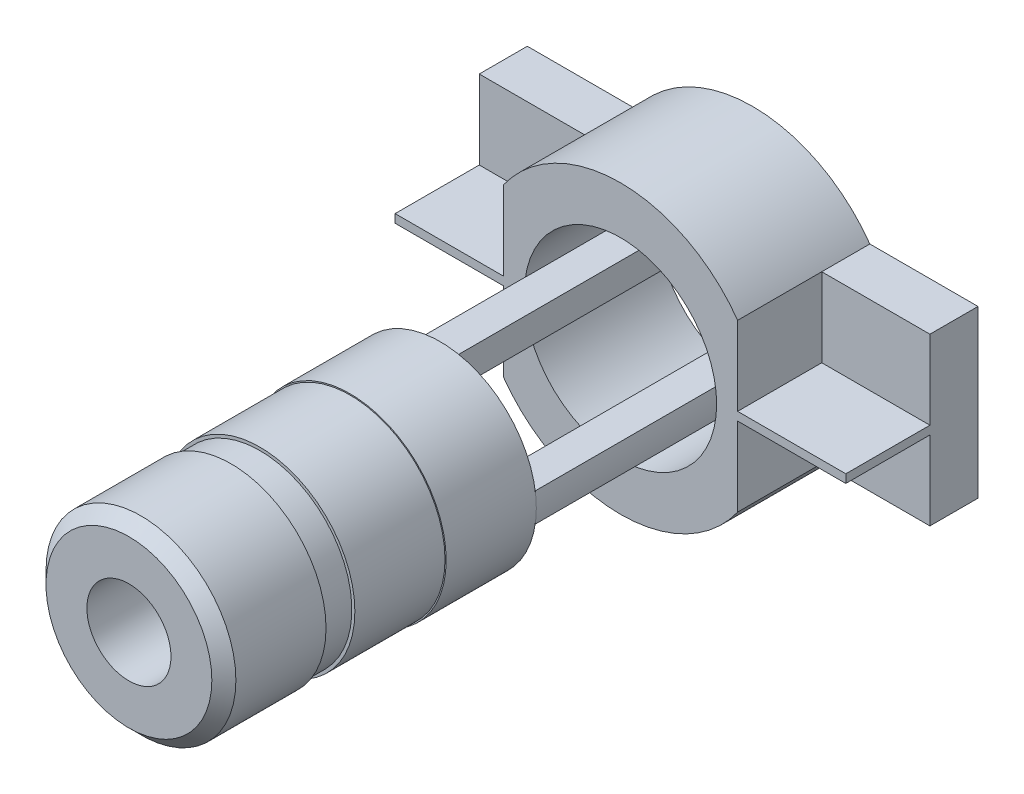
from build123d import *

# Parameters (mm, degrees)
SKETCH1_R             = 7.9
SKETCH1_R_2           = 3.5
BOSS_EXTRUDE1_DEPTH   = 18.4
CHAMFER1_SIZE         = 1
CUT_EXTRUDE6_START    = 2.4
SKETCH19_R            = 7.9
SKETCH19_R_2          = 7.65
CUT_EXTRUDE6_DEPTH    = 2.4
SKETCH24_R            = 8
BOSS_EXTRUDE5_DEPTH   = 7.5
BOSS_EXTRUDE6_DEPTH   = 26
BOSS_EXTRUDE6_2_DEPTH = 26
SKETCH26_R            = 11.95
SKETCH26_R_2          = 8
BOSS_EXTRUDE7_DEPTH   = 11
CUT_EXTRUDE9_DEPTH    = 45.253982872
SKETCH28_R            = 3.5
CUT_EXTRUDE10_DEPTH   = 31.230200132
SKETCH29_W            = 4
SKETCH29_H            = 13.818827736
BOSS_EXTRUDE8_DEPTH   = 9
SKETCH30_W            = 4
SKETCH30_H            = 13.818827736
BOSS_EXTRUDE9_DEPTH   = 9
BOSS_EXTRUDE10_DEPTH  = 9
BOSS_EXTRUDE11_DEPTH  = 9


with BuildPart() as part:
    # Sketch1 → Boss-Extrude1 (new body)
    with BuildSketch(Plane.XY):
        Circle(SKETCH1_R)
        Circle(SKETCH1_R_2, mode=Mode.SUBTRACT)
    extrude(amount=BOSS_EXTRUDE1_DEPTH)

    # Chamfer1
    chamfer1_edges = [part.edges().sort_by_distance(p)[0] for p in [
        (-7.9, 0, 18.4),
    ]]
    chamfer(chamfer1_edges, length=CHAMFER1_SIZE)

    # Sketch19 → Cut-Extrude6 (cut)
    with BuildSketch(Plane(origin=(0, 0, 9.9), x_dir=(-1, 0, 0), z_dir=(0, 0, -1)).offset(CUT_EXTRUDE6_START)):
        Circle(SKETCH19_R)
        Circle(SKETCH19_R_2, mode=Mode.SUBTRACT)
    extrude(amount=-CUT_EXTRUDE6_DEPTH, mode=Mode.SUBTRACT)


with BuildPart() as body_2:
    # Sketch24 → Boss-Extrude5 (new body)
    with BuildSketch(Plane(origin=(0, 0, 0), x_dir=(-1, 0, 0), z_dir=(0, 0, -1))):
        Circle(SKETCH24_R)
    extrude(amount=BOSS_EXTRUDE5_DEPTH)

    # Sketch28 → Cut-Extrude10 (cut, through all)
    with BuildSketch(Plane(origin=(0, 0, -7.5), x_dir=(-1, 0, 0), z_dir=(0, 0, -1))):
        Circle(SKETCH28_R)
    extrude(amount=-CUT_EXTRUDE10_DEPTH, mode=Mode.SUBTRACT)


with BuildPart() as body_3:
    # Sketch25 → Boss-Extrude6 (new body)
    with BuildSketch(Plane(origin=(0, 0, -7.5), x_dir=(-1, 0, 0), z_dir=(0, 0, -1))):
        with BuildLine():
            Line((-5.109487973, 1.2), (-7.909487973, 1.2))
            ThreePointArc((-7.909487973, 1.2), (-7.977339901, 0.601704335), (-8, 0))
            ThreePointArc((-8, 0), (-7.977339901, -0.601704335), (-7.909487973, -1.2))
            Line((-7.909487973, -1.2), (-5.109487973, -1.2))
            Line((-5.109487973, -1.2), (-5.109487973, 0))
            Line((-5.109487973, 0), (-5.109487973, 1.2))
        make_face()
    extrude(amount=BOSS_EXTRUDE6_DEPTH)


with BuildPart() as body_4:
    # Sketch25 → Boss-Extrude6 2 (new body)
    with BuildSketch(Plane(origin=(0, 0, -7.5), x_dir=(-1, 0, 0), z_dir=(0, 0, -1))):
        with BuildLine():
            Line((5.109487973, 1.2), (7.909487973, 1.2))
            ThreePointArc((7.909487973, 1.2), (8, 0), (7.909487973, -1.2))
            Line((7.909487973, -1.2), (5.109487973, -1.2))
            Line((5.109487973, -1.2), (5.109487973, 0))
            Line((5.109487973, 0), (5.109487973, 1.2))
        make_face()
    extrude(amount=BOSS_EXTRUDE6_2_DEPTH)


with BuildPart() as body_5:
    # Sketch26 → Boss-Extrude7 (new body)
    with BuildSketch(Plane(origin=(0, 0, -33.5), x_dir=(-1, 0, 0), z_dir=(0, 0, -1))):
        Circle(SKETCH26_R)
        Circle(SKETCH26_R_2, mode=Mode.SUBTRACT)
    extrude(amount=-BOSS_EXTRUDE7_DEPTH)

    # Sketch27 → Cut-Extrude9 (cut, through all)
    with BuildSketch(Plane.XY.offset(-22.5)):
        with BuildLine():
            Line((-9.75, 0), (-9.75, 6.909413868))
            ThreePointArc((-9.75, 6.909413868), (-11.95, 0), (-9.75, -6.909413868))
            Line((-9.75, -6.909413868), (-9.75, 0))
        make_face()
        with BuildLine():
            Line((9.75, 0), (9.75, 6.909413868))
            ThreePointArc((9.75, 6.909413868), (11.95, 0), (9.75, -6.909413868))
            Line((9.75, -6.909413868), (9.75, 0))
        make_face()
    extrude(amount=-CUT_EXTRUDE9_DEPTH, mode=Mode.SUBTRACT)

    # Sketch29 → Boss-Extrude8 (add)
    with BuildSketch(Plane.ZY.offset(9.75)):
        with Locations((-31.5, 0)):
            Rectangle(SKETCH29_W, SKETCH29_H)
    extrude(amount=BOSS_EXTRUDE8_DEPTH)

    # Sketch30 → Boss-Extrude9 (add)
    with BuildSketch(Plane(origin=(9.75, 0, 0), x_dir=(0, 0, -1), z_dir=(1, 0, 0))):
        with Locations((31.5, 0)):
            Rectangle(SKETCH30_W, SKETCH30_H)
    extrude(amount=BOSS_EXTRUDE9_DEPTH)

    # Sketch31 → Boss-Extrude10 (add)
    with BuildSketch(Plane(origin=(9.75, 0, 0), x_dir=(0, 0, -1), z_dir=(1, 0, 0))):
        Polygon((22.5, 0), (22.5, 0.35), (29.5, 0.35), (29.5, -0.35), (22.5, -0.35), align=None)
    extrude(amount=BOSS_EXTRUDE10_DEPTH)

    # Sketch32 → Boss-Extrude11 (add)
    with BuildSketch(Plane.ZY.offset(9.75)):
        Polygon((-22.5, 0), (-22.5, 0.35), (-29.5, 0.35), (-29.5, -0.35), (-22.5, -0.35), align=None)
    extrude(amount=BOSS_EXTRUDE11_DEPTH)


solid = Compound([part.part, body_2.part, body_3.part, body_4.part, body_5.part])
